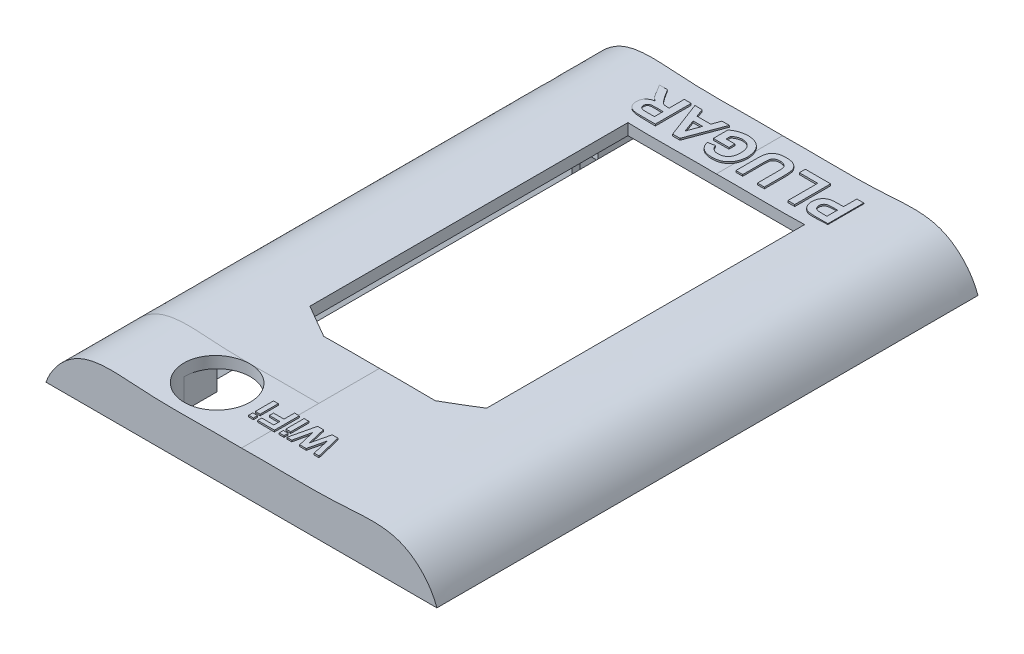
from build123d import *
from build123d.topology import SkipClean

# Parameters (mm, degrees)
CORPO_DA_TAMPA_DEPTH      = 84
TAMPA_SUPERIOR_DEPTH      = 14
ESBO_O6_W                 = 1.5
ESBO_O6_H                 = 2.969848481
ESBO_O6_W_2               = 13
GANCHO_TAMPA_DEPTH        = 1.5
GANCHO_TAMPA_TAPER        = -45
FURO_FURO_DEPTH           = 10
FURO_INTERNO_ANTENA_DEPTH = 5.369848481
FURO_ANTENA_R             = 6
CORTE_ANTENA_DEPTH        = 105.335973185
ESCRITO_W                 = 0.865384615
ESCRITO_H                 = 0.75
ESCRITO_H_2               = 3.288461538
ESCRITO_W_2               = 0.865384616
TEXTO_DEPTH               = 2.3


with BuildPart() as part:
    # Forma Principal → Corpo da Tampa (new body)
    with BuildSketch(Plane.XY):
        with BuildLine():
            Line((20.4, -12.030151519), (20.4, -9.630151519))
            Line((20.4, -9.630151519), (-20.4, -9.630151519))
            Line((-20.4, -9.630151519), (-20.4, -12.030151519))
            Line((-20.4, -12.030151519), (-18.91507576, -13.51507576))
            Line((-18.91507576, -13.51507576), (-20.4, -15))
            Line((-20.4, -15), (-35.4, -15))
            add(Edge.make_bspline(
                [(-35.4, -15), (-34.365163963, -12.038536121), (-29.36590771, -6.479950712), (-20.61057975, -7.407625726), (-11.04542218, -7.7779604), (-4.640956428, -7.543958391), (0, -7.630151519)],
                knots=[0, 0, 0, 0, 0.248558423, 0.508028441, 0.637570911, 1, 1, 1, 1], degree=3))
            add(Edge.make_bspline(
                [(35.4, -15), (34.365163963, -12.038536121), (29.36590771, -6.479950712), (20.61057975, -7.407625726), (11.04542218, -7.7779604), (4.640956428, -7.543958391), (0, -7.630151519)],
                knots=[0, 0, 0, 0, 0.248558423, 0.508028441, 0.637570911, 1, 1, 1, 1], degree=3))
            Line((35.4, -15), (20.4, -15))
            Line((20.4, -15), (18.91507576, -13.51507576))
            Line((18.91507576, -13.51507576), (20.4, -12.030151519))
        make_face()
    extrude(amount=CORPO_DA_TAMPA_DEPTH)

    # Esboço4 → Tampa Superior (add)
    with BuildSketch(Plane.XY.offset(84)):
        with BuildLine():
            Line((-35.4, -15), (35.4, -15))
            add(Edge.make_bspline(
                [(35.4, -15), (34.365164156, -12.038535769), (29.365907501, -6.479950972), (20.610579631, -7.407625041), (11.045422136, -7.777961222), (4.640956426, -7.543957764), (0, -7.630151526)],
                knots=[0, 0, 0, 0, 0.248558429, 0.508028447, 0.637570912, 1, 1, 1, 1], degree=3))
            add(Edge.make_bspline(
                [(-35.4, -15), (-34.365164156, -12.038535769), (-29.365907501, -6.479950972), (-20.610579631, -7.407625041), (-11.045422136, -7.777961222), (-4.640956426, -7.543957764), (0, -7.630151526)],
                knots=[0, 0, 0, 0, 0.248558429, 0.508028447, 0.637570912, 1, 1, 1, 1], degree=3))
        make_face()
    extrude(amount=TAMPA_SUPERIOR_DEPTH)

    # Esboço6 → Gancho Tampa (cut)
    with BuildSketch(Plane.ZY.offset(-20.4)):
        with Locations((17, -13.51507576)):
            Rectangle(ESBO_O6_W, ESBO_O6_H)
        with Locations((6.5, -13.51507576)):
            Rectangle(ESBO_O6_W_2, ESBO_O6_H)
    gancho_tampa = extrude(amount=GANCHO_TAMPA_DEPTH, taper=GANCHO_TAMPA_TAPER, mode=Mode.SUBTRACT)

    # Furo → Furo Furo (cut)
    with BuildSketch(Plane.XZ.offset(9.630151519)):
        Polygon((-16, 69.593633412), (-10.1, 73), (10.1, 73), (16, 69.593633412), (16, 12), (-16, 12), align=None)
    extrude(amount=-FURO_FURO_DEPTH, mode=Mode.SUBTRACT)

    # Gancho Espelho: Gancho Tampa across plane
    add(gancho_tampa.mirror(Plane(origin=(0, 0, 0), x_dir=(0, 0, 1), z_dir=(1, 0, 0))), mode=Mode.SUBTRACT)

    # Esboço Antena → Furo Interno Antena (cut)
    with BuildSketch(Plane.XZ.offset(15)):
        with BuildLine():
            Line((-6.4, 90), (-6.4, 84))
            Line((-6.4, 84), (-18.4, 84))
            Line((-18.4, 84), (-18.4, 90))
            ThreePointArc((-18.4, 90), (-12.4, 96), (-6.4, 90))
        make_face()
    extrude(amount=-FURO_INTERNO_ANTENA_DEPTH, mode=Mode.SUBTRACT)

    # Furo Antena → Corte Antena (cut, through all)
    with BuildSketch(Plane.XZ.offset(9.630151519)):
        with Locations((-12.4, 90)):
            Circle(FURO_ANTENA_R)
    extrude(amount=-CORTE_ANTENA_DEPTH, mode=Mode.SUBTRACT)

    # Escrito → Texto (add)
    # profile 1 of 12: a face of its own
    with SkipClean():  # the faces are left unmerged after this step: merging them gives an invalid solid
        with BuildSketch(Plane.XZ.offset(9.630151519)):
            with BuildLine():
                Line((-13.041666667, 3.5), (-13.041666667, 10))
                Line((-13.041666667, 10), (-15.76953125, 10))
                add(Edge.make_bspline(
                    [(-15.76953125, 10), (-15.852433751, 9.999489074), (-16.012202043, 9.998504425), (-16.243258164, 9.991324173), (-16.456343771, 9.976281126), (-16.652404118, 9.959244751), (-16.830497509, 9.934457924), (-16.991328096, 9.90476355), (-17.134625107, 9.870351864), (-17.262479332, 9.829138289), (-17.379056412, 9.781967921), (-17.487653682, 9.725821912), (-17.5894652, 9.660039962), (-17.686054692, 9.586889393), (-17.777831175, 9.506257808), (-17.862278626, 9.416011295), (-17.940868343, 9.317493655), (-18.013536914, 9.211524561), (-18.077553377, 9.098571929), (-18.136047616, 8.982263258), (-18.183664134, 8.861360851), (-18.222994944, 8.736434247), (-18.254413002, 8.607754678), (-18.276219789, 8.474994995), (-18.289833531, 8.338395496), (-18.291048832, 8.246126495), (-18.291666667, 8.19921875)],
                    knots=[0, 0, 0, 0, 1.675828044, 3.229627355, 4.67171229, 5.993455049, 7.206927059, 8.304770529, 9.29850117, 10.183580433, 11.017754134, 11.837875825, 12.650738409, 13.464925643, 14.285328857, 15.117007378, 15.959673368, 16.830859064, 17.711229498, 18.58228265, 19.460420693, 20.334473227, 21.228207035, 22.135446768, 23.052097822, 24, 24, 24, 24], degree=3))
                add(Edge.make_bspline(
                    [(-18.291666667, 8.19921875), (-18.290520676, 8.14012812), (-18.288281093, 8.024648743), (-18.267671273, 7.855391914), (-18.237060425, 7.693679097), (-18.193424898, 7.539286251), (-18.133426936, 7.394029257), (-18.063776636, 7.255873273), (-17.980706952, 7.125286925), (-17.884782253, 7.003564777), (-17.776088417, 6.890599081), (-17.654149103, 6.788714583), (-17.519834922, 6.697513096), (-17.372333353, 6.617520543), (-17.212671459, 6.549135577), (-17.040156893, 6.491598551), (-16.855570628, 6.444769821), (-16.727172525, 6.422735504), (-16.661458333, 6.411458333)],
                    knots=[0, 0, 0, 0, 1.05911256, 2.069797862, 3.05271628, 4.008392045, 4.940519534, 5.866323021, 6.779546087, 7.71056835, 8.640711998, 9.585328432, 10.554502533, 11.547017206, 12.589327225, 13.664782803, 14.804835066, 16, 16, 16, 16], degree=3))
                add(Edge.make_bspline(
                    [(-16.661458333, 6.411458333), (-16.725011337, 6.369366581), (-16.849393223, 6.286987288), (-17.021484516, 6.15130756), (-17.175981665, 6.008901192), (-17.292959113, 5.88226459), (-17.382844227, 5.770901302), (-17.455217101, 5.673501898), (-17.533282847, 5.561409311), (-17.616275811, 5.434562808), (-17.706649476, 5.294084679), (-17.801042682, 5.137824691), (-17.901430742, 4.967307026), (-17.968925799, 4.848191804), (-18.00390625, 4.786458333)],
                    knots=[0, 0, 0, 0, 1.285445069, 2.515791127, 3.691898215, 4.826622834, 5.420063933, 6.105349801, 6.873086501, 7.723915395, 8.66222816, 9.690593598, 10.803111229, 12, 12, 12, 12], degree=3))
                Line((-18.00390625, 4.786458333), (-18.791666667, 3.5))
                Line((-18.791666667, 3.5), (-17.330729167, 3.5))
                Line((-17.330729167, 3.5), (-16.40625, 4.975260417))
                add(Edge.make_bspline(
                    [(-16.40625, 4.975260417), (-16.363792405, 5.034343532), (-16.282732128, 5.147145345), (-16.165716611, 5.307440382), (-16.058657797, 5.450131756), (-15.96440488, 5.577286268), (-15.878188701, 5.685298788), (-15.802627128, 5.776051602), (-15.739259251, 5.851492131), (-15.667558341, 5.926294672), (-15.584141945, 6.003170848), (-15.480879109, 6.077706677), (-15.374837757, 6.137125853), (-15.261222919, 6.182464081), (-15.129830791, 6.214076906), (-14.971876645, 6.234218294), (-14.782394035, 6.249078384), (-14.645436069, 6.249677221), (-14.571614583, 6.25)],
                    knots=[0, 0, 0, 0, 1.465447777, 2.797841088, 3.997266218, 5.05856206, 5.985598736, 6.780315439, 7.437430484, 7.969193402, 8.866571936, 9.718200644, 10.52825214, 11.309096006, 12.174169268, 13.242355782, 14.513606761, 16, 16, 16, 16], degree=3))
                Line((-14.571614583, 6.25), (-14.291666667, 6.25))
                Line((-14.291666667, 6.25), (-14.291666667, 3.5))
                Line((-14.291666667, 3.5), (-13.041666667, 3.5))
            make_face()
            with BuildLine():
                Line((-14.291666667, 7.333333333), (-15.298177083, 7.333333333))
                add(Edge.make_bspline(
                    [(-15.298177083, 7.333333333), (-15.375871807, 7.333499838), (-15.523893384, 7.333817057), (-15.73438301, 7.33841185), (-15.922421124, 7.342311716), (-16.086882458, 7.352110297), (-16.228502825, 7.361821614), (-16.346714115, 7.374442802), (-16.44251229, 7.38936064), (-16.538198566, 7.41255396), (-16.636213824, 7.452963742), (-16.740679544, 7.510519167), (-16.829963809, 7.585184161), (-16.907304605, 7.671504445), (-16.966304797, 7.772981789), (-17.012515903, 7.885095263), (-17.035945912, 8.010336129), (-17.039719793, 8.097144358), (-17.041666667, 8.141927083)],
                    knots=[0, 0, 0, 0, 1.697953026, 3.23488743, 4.60134403, 5.807846676, 6.835100678, 7.703488618, 8.405232423, 8.952775585, 9.851109663, 10.713519226, 11.549115941, 12.382556273, 13.233359028, 14.101746968, 15.020727134, 16, 16, 16, 16], degree=3))
                add(Edge.make_bspline(
                    [(-17.041666667, 8.141927083), (-17.039452464, 8.19202582), (-17.035180516, 8.288683254), (-17.00149133, 8.426227704), (-16.942688229, 8.547729289), (-16.861929251, 8.65338861), (-16.760549078, 8.742608865), (-16.63979408, 8.813430327), (-16.500561383, 8.866175214), (-16.40013777, 8.885653798), (-16.34765625, 8.895833333)],
                    knots=[0, 0, 0, 0, 1.062977961, 2.050844577, 2.982300261, 3.90936959, 4.856017476, 5.831122378, 6.86654153, 8, 8, 8, 8], degree=3))
                add(Edge.make_bspline(
                    [(-16.34765625, 8.895833333), (-16.33030843, 8.897739486), (-16.289190456, 8.902257468), (-16.216580986, 8.905159169), (-16.123740465, 8.9096194), (-16.00954515, 8.911442197), (-15.875015255, 8.914637399), (-15.719615829, 8.915224119), (-15.543840589, 8.917098647), (-15.419705613, 8.916815931), (-15.354166667, 8.916666667)],
                    knots=[0, 0, 0, 0, 0.42127143, 0.998501726, 1.753681744, 2.66564073, 3.755712164, 5.002818897, 6.417592707, 8, 8, 8, 8], degree=3))
                Line((-15.354166667, 8.916666667), (-14.291666667, 8.916666667))
                Line((-14.291666667, 8.916666667), (-14.291666667, 7.333333333))
            make_face(mode=Mode.SUBTRACT)
        # profile 2 of 12: a face of its own
        with BuildSketch(Plane.XZ.offset(9.630151519)):
            Polygon((-12.375, 3.5), (-11.049479167, 3.5), (-10.501302083, 5), (-8.006510417, 5), (-7.458333333, 3.5), (-6.125, 3.5), (-8.58203125, 10), (-9.90625, 10), align=None)
            Polygon((-10.104166667, 6.083333333), (-9.25, 8.416666667), (-8.3984375, 6.083333333), align=None, mode=Mode.SUBTRACT)
        # profile 3 of 12: a face of its own
        with BuildSketch(Plane.XZ.offset(9.630151519)):
            with BuildLine():
                Line((-2.708333333, 5.916666667), (-2.708333333, 7))
                Line((-2.708333333, 7), (-5.541666667, 7))
                Line((-5.541666667, 7), (-5.541666667, 4.388020833))
                add(Edge.make_bspline(
                    [(-5.541666667, 4.388020833), (-5.506007566, 4.355910677), (-5.433113149, 4.290271021), (-5.314177681, 4.197702685), (-5.183240935, 4.109327816), (-5.04109445, 4.0233566), (-4.887444053, 3.940480978), (-4.722902584, 3.859546703), (-4.547166457, 3.781345288), (-4.298649881, 3.683382026), (-3.978758103, 3.576789901), (-3.587684009, 3.484104585), (-3.193516266, 3.427257023), (-2.929871012, 3.420194487), (-2.798177083, 3.416666667)],
                    knots=[0, 0, 0, 0, 0.581799769, 1.189316438, 1.825828404, 2.496525428, 3.203088405, 3.942228803, 4.719818701, 5.534979611, 7.181138583, 8.803804008, 10.403462225, 12, 12, 12, 12], degree=3))
                add(Edge.make_bspline(
                    [(-2.798177083, 3.416666667), (-2.715675138, 3.417906431), (-2.553039266, 3.420350376), (-2.312951659, 3.440021571), (-2.081169963, 3.473678895), (-1.857505293, 3.52133928), (-1.64120056, 3.578792799), (-1.433157397, 3.652083655), (-1.234114423, 3.740063474), (-1.042268303, 3.838098812), (-0.861195513, 3.950700377), (-0.690721129, 4.073876443), (-0.532079017, 4.208698409), (-0.385837905, 4.35543804), (-0.250039404, 4.513084711), (-0.126267979, 4.682390177), (-0.015272121, 4.863549897), (0.084318264, 5.054291422), (0.172917972, 5.252937232), (0.247680603, 5.457923884), (0.313225126, 5.666275196), (0.367095562, 5.878722642), (0.406660761, 6.095956925), (0.437417938, 6.316972915), (0.453937525, 6.543151533), (0.456858114, 6.695289152), (0.458333333, 6.772135417)],
                    knots=[0, 0, 0, 0, 1.124918047, 2.217548049, 3.282233239, 4.316494221, 5.334437038, 6.332151046, 7.320712088, 8.300141923, 9.267552434, 10.225301062, 11.165776911, 12.103230934, 13.047553934, 14.000517593, 14.959782875, 15.941944936, 16.932894943, 17.923491392, 18.915624898, 19.910402922, 20.909870877, 21.92519501, 22.95199481, 24, 24, 24, 24], degree=3))
                add(Edge.make_bspline(
                    [(0.458333333, 6.772135417), (0.457136949, 6.855076983), (0.454778358, 7.018590656), (0.434450611, 7.260261964), (0.402884024, 7.494851407), (0.35501536, 7.721933098), (0.29677831, 7.942564087), (0.2257033, 8.156599079), (0.138620724, 8.362452285), (0.041749279, 8.561884202), (-0.068525904, 8.752136891), (-0.193130659, 8.930770052), (-0.328377592, 9.099585394), (-0.476939291, 9.255901428), (-0.638292594, 9.399641986), (-0.810797261, 9.532396736), (-0.994040183, 9.656454209), (-1.125192095, 9.726403649), (-1.19140625, 9.76171875)],
                    knots=[0, 0, 0, 0, 1.105010302, 2.178452875, 3.229459892, 4.257086284, 5.268538906, 6.268935615, 7.259234261, 8.24469117, 9.221745683, 10.185929258, 11.144249683, 12.101504986, 13.055838221, 14.020611351, 15.000673771, 16, 16, 16, 16], degree=3))
                add(Edge.make_bspline(
                    [(-1.19140625, 9.76171875), (-1.243954007, 9.787810667), (-1.350682814, 9.840805493), (-1.520488792, 9.904077591), (-1.698082328, 9.961649054), (-1.886144697, 10.004604427), (-2.083398807, 10.039895584), (-2.289757239, 10.066232057), (-2.505883876, 10.080062354), (-2.652759939, 10.082226635), (-2.727864583, 10.083333333)],
                    knots=[0, 0, 0, 0, 0.887969848, 1.803539625, 2.741143579, 3.713741423, 4.722068772, 5.775476617, 6.8624965, 8, 8, 8, 8], degree=3))
                add(Edge.make_bspline(
                    [(-2.727864583, 10.083333333), (-2.824698333, 10.081890986), (-3.013022072, 10.079085886), (-3.287583984, 10.055712186), (-3.545982622, 10.015428383), (-3.788577826, 9.959946623), (-4.014846969, 9.888611807), (-4.224400534, 9.800914265), (-4.418524711, 9.698618885), (-4.594407848, 9.577625955), (-4.755624534, 9.444217091), (-4.901754079, 9.298230017), (-5.0328553, 9.139448498), (-5.14901493, 8.968671478), (-5.249318716, 8.785193066), (-5.335560814, 8.590686624), (-5.406548502, 8.383675523), (-5.440855278, 8.239909983), (-5.458333333, 8.166666667)],
                    knots=[0, 0, 0, 0, 1.271135529, 2.472123572, 3.614091059, 4.701890498, 5.736279567, 6.724681829, 7.680621489, 8.611506429, 9.52200816, 10.424540711, 11.318996785, 12.221421405, 13.131851814, 14.060431888, 15.011860567, 16, 16, 16, 16], degree=3))
                Line((-5.458333333, 8.166666667), (-4.208333333, 7.916666667))
                add(Edge.make_bspline(
                    [(-4.208333333, 7.916666667), (-4.195955961, 7.957684905), (-4.171535636, 8.038613125), (-4.124195238, 8.154780248), (-4.069669493, 8.263985027), (-4.007827609, 8.367017899), (-3.938046579, 8.463244545), (-3.858640498, 8.551626968), (-3.77460448, 8.636196645), (-3.680450189, 8.711067141), (-3.58008924, 8.778562552), (-3.474652485, 8.839425952), (-3.361757503, 8.888784473), (-3.242985662, 8.928498772), (-3.118917472, 8.962226691), (-2.987933794, 8.982969491), (-2.851505551, 8.998613571), (-2.758295387, 8.999532907), (-2.7109375, 9)],
                    knots=[0, 0, 0, 0, 1.027736275, 2.027704492, 3.005900071, 3.954421694, 4.908588141, 5.853155543, 6.803277083, 7.766271258, 8.734041521, 9.704274878, 10.683578894, 11.68490234, 12.708089448, 13.76461009, 14.864251086, 16, 16, 16, 16], degree=3))
                add(Edge.make_bspline(
                    [(-2.7109375, 9), (-2.63925968, 8.998087612), (-2.499374308, 8.994355425), (-2.295160306, 8.970002099), (-2.10250313, 8.926675299), (-1.920898993, 8.866914239), (-1.750014961, 8.790206733), (-1.592160208, 8.693691754), (-1.443404245, 8.583080237), (-1.307980146, 8.453259914), (-1.185165874, 8.307694238), (-1.078848154, 8.144646922), (-0.990339107, 7.964645001), (-0.917845153, 7.76859232), (-0.860124497, 7.556480703), (-0.820967535, 7.327559271), (-0.795383089, 7.082179215), (-0.792930898, 6.912829422), (-0.791666667, 6.825520833)],
                    knots=[0, 0, 0, 0, 1.043810997, 2.037086103, 2.989314757, 3.91471467, 4.817033861, 5.710208705, 6.603920097, 7.511448416, 8.435617211, 9.371747005, 10.338444094, 11.350425613, 12.411431869, 13.5347293, 14.729025275, 16, 16, 16, 16], degree=3))
                add(Edge.make_bspline(
                    [(-0.791666667, 6.825520833), (-0.792985002, 6.731713813), (-0.795547265, 6.549394393), (-0.820461086, 6.285225338), (-0.861444539, 6.039103928), (-0.920228259, 5.811340609), (-0.994196487, 5.601127312), (-1.083109603, 5.407792501), (-1.192839135, 5.23492372), (-1.316440072, 5.07905586), (-1.454588205, 4.9428595), (-1.603409589, 4.824119799), (-1.762075674, 4.723492208), (-1.932049601, 4.642565105), (-2.111187611, 4.578145046), (-2.301136586, 4.532982112), (-2.501330938, 4.504928561), (-2.638360256, 4.501666003), (-2.708333333, 4.5)],
                    knots=[0, 0, 0, 0, 1.318042826, 2.561693173, 3.724929596, 4.821196409, 5.862977565, 6.853497791, 7.804600806, 8.73339865, 9.643480846, 10.524649628, 11.404635349, 12.277659519, 13.165160235, 14.075017549, 15.017020959, 16, 16, 16, 16], degree=3))
                add(Edge.make_bspline(
                    [(-2.708333333, 4.5), (-2.779205662, 4.501970029), (-2.921628312, 4.505928932), (-3.134950995, 4.53947663), (-3.349108325, 4.588843148), (-3.559074259, 4.663313457), (-3.762986489, 4.748730378), (-3.953360333, 4.84717187), (-4.131639573, 4.949784224), (-4.238984443, 5.029760182), (-4.291666667, 5.069010417)],
                    knots=[0, 0, 0, 0, 0.993821502, 1.997150276, 3.023717651, 4.073291794, 5.118404464, 6.123376694, 7.078999408, 8, 8, 8, 8], degree=3))
                Line((-4.291666667, 5.069010417), (-4.291666667, 5.916666667))
                Line((-4.291666667, 5.916666667), (-2.708333333, 5.916666667))
            make_face()
        # profile 4 of 12: a face of its own
        with BuildSketch(Plane.XZ.offset(9.630151519)):
            with BuildLine():
                Line((6.708333333, 10), (5.458333333, 10))
                Line((5.458333333, 10), (5.458333333, 6.47265625))
                add(Edge.make_bspline(
                    [(5.458333333, 6.47265625), (5.45785613, 6.405816046), (5.456945102, 6.278211752), (5.456317991, 6.095904516), (5.452847482, 5.932220815), (5.445321342, 5.786896898), (5.440155944, 5.660006878), (5.430564361, 5.551527465), (5.420996024, 5.461500906), (5.411693303, 5.407952365), (5.407552083, 5.384114583)],
                    knots=[0, 0, 0, 0, 1.470600056, 2.807515117, 4.011048972, 5.072079398, 6.00911328, 6.804506435, 7.467811572, 8, 8, 8, 8], degree=3))
                add(Edge.make_bspline(
                    [(5.407552083, 5.384114583), (5.390478864, 5.319851409), (5.356859539, 5.193309104), (5.264192315, 5.020329133), (5.141780222, 4.867858182), (5.016915374, 4.759121851), (4.903965499, 4.682166344), (4.808023836, 4.635330113), (4.706230358, 4.592635876), (4.596433097, 4.55987695), (4.479810464, 4.531211711), (4.35495378, 4.514637269), (4.222916761, 4.501916797), (4.132413794, 4.500650359), (4.0859375, 4.5)],
                    knots=[0, 0, 0, 0, 1.376921055, 2.711331395, 4.038631339, 5.418057255, 6.132954575, 6.870556231, 7.630397752, 8.422890386, 9.247036838, 10.121396817, 11.035274583, 12, 12, 12, 12], degree=3))
                add(Edge.make_bspline(
                    [(4.0859375, 4.5), (4.039048001, 4.500850429), (3.947755104, 4.502506197), (3.815456111, 4.512366871), (3.692023412, 4.530970564), (3.577532516, 4.555363599), (3.471378722, 4.586192307), (3.374408909, 4.625225075), (3.286775887, 4.672197473), (3.183808407, 4.742996483), (3.073015534, 4.842870847), (2.966391538, 4.978662803), (2.890081578, 5.12856235), (2.854288973, 5.265431848), (2.835892776, 5.38468204), (2.824684823, 5.489030099), (2.814434584, 5.607115894), (2.805126583, 5.738615991), (2.798761104, 5.883629096), (2.795318128, 6.042521957), (2.792608487, 6.215269234), (2.79198809, 6.335068274), (2.791666667, 6.397135417)],
                    knots=[0, 0, 0, 0, 1.036876239, 2.018776863, 2.930845756, 3.794842666, 4.605604932, 5.371924355, 6.101864688, 6.799283669, 8.1310906, 9.382718023, 10.597336334, 11.822035891, 12.492591141, 13.265194674, 14.141890321, 15.11351293, 16.179860579, 17.351049011, 18.627594861, 20, 20, 20, 20], degree=3))
                Line((2.791666667, 6.397135417), (2.791666667, 10))
                Line((2.791666667, 10), (1.541666667, 10))
                Line((1.541666667, 10), (1.541666667, 6.600260417))
                add(Edge.make_bspline(
                    [(1.541666667, 6.600260417), (1.541826882, 6.506509478), (1.542134731, 6.326369627), (1.546941362, 6.067193325), (1.55715698, 5.829409933), (1.565711679, 5.612611855), (1.58221334, 5.417352165), (1.599490524, 5.243509458), (1.62174747, 5.091114117), (1.653486082, 4.917894665), (1.706824884, 4.723553585), (1.792788694, 4.508878938), (1.902653027, 4.313570963), (2.035980096, 4.136880282), (2.192001829, 3.978104633), (2.373054322, 3.837868217), (2.57727582, 3.714466155), (2.764421237, 3.625608958), (2.927588065, 3.565775434), (3.060484717, 3.525282786), (3.202714607, 3.491560882), (3.354110926, 3.464799552), (3.514738725, 3.442235791), (3.684656326, 3.427166896), (3.86360666, 3.417762843), (3.985664622, 3.417037932), (4.048177083, 3.416666667)],
                    knots=[0, 0, 0, 0, 1.415574045, 2.719986624, 3.913607924, 5.00929969, 5.995467356, 6.871900228, 7.64671288, 8.320227872, 9.530145585, 10.682614022, 11.803571353, 12.90325401, 14.015460715, 15.154679255, 16.351678057, 17.612271512, 18.275764165, 18.974412946, 19.708786676, 20.481351116, 21.295095879, 22.157200529, 23.056203067, 24, 24, 24, 24], degree=3))
                add(Edge.make_bspline(
                    [(4.048177083, 3.416666667), (4.123269151, 3.417626538), (4.268733679, 3.419485953), (4.479887536, 3.427780642), (4.676629197, 3.444901198), (4.859576787, 3.468041232), (5.028654771, 3.497788503), (5.184290876, 3.533351179), (5.325242576, 3.578297383), (5.493127363, 3.642491429), (5.680262962, 3.7406868), (5.88396798, 3.871678626), (6.062785955, 4.019526159), (6.215145702, 4.182784743), (6.34251252, 4.355717102), (6.44603924, 4.53458117), (6.529002146, 4.716395689), (6.563668757, 4.842760338), (6.580729167, 4.904947917)],
                    knots=[0, 0, 0, 0, 1.128613534, 2.186292659, 3.174878439, 4.095586888, 4.95671962, 5.754129884, 6.492676435, 7.178284149, 8.453103036, 9.659838108, 10.813193309, 11.929983019, 13.007587775, 14.033493319, 15.032227051, 16, 16, 16, 16], degree=3))
                add(Edge.make_bspline(
                    [(6.580729167, 4.904947917), (6.591170738, 4.953907511), (6.613164027, 5.057032072), (6.638142298, 5.220979908), (6.660929841, 5.401513934), (6.67649403, 5.598847691), (6.691247456, 5.812355075), (6.701839894, 6.042438656), (6.706195514, 6.289046188), (6.707606371, 6.459200681), (6.708333333, 6.546875)],
                    knots=[0, 0, 0, 0, 0.728071598, 1.533551606, 2.411422299, 3.374601532, 4.412367648, 5.524718474, 6.72457895, 8, 8, 8, 8], degree=3))
                Line((6.708333333, 6.546875), (6.708333333, 10))
            make_face()
        # profile 5 of 12: a face of its own
        with BuildSketch(Plane.XZ.offset(9.630151519)):
            Polygon((12.208333333, 3.5), (12.208333333, 10), (10.958333333, 10), (10.958333333, 4.583333333), (7.625, 4.583333333), (7.625, 3.5), align=None)
        # profile 6 of 12: a face of its own
        with BuildSketch(Plane.XZ.offset(9.630151519)):
            with BuildLine():
                Line((18.208333333, 3.5), (18.208333333, 10))
                Line((18.208333333, 10), (16.12890625, 10))
                add(Edge.make_bspline(
                    [(16.12890625, 10), (16.034719144, 9.999897143), (15.854575105, 9.999700417), (15.597610532, 9.99423455), (15.36625243, 9.986497013), (15.160844174, 9.976860238), (14.980662986, 9.962480319), (14.826517137, 9.945828589), (14.697435982, 9.927915746), (14.621423914, 9.909378349), (14.587239583, 9.901041667)],
                    knots=[0, 0, 0, 0, 1.460485487, 2.793352117, 3.985295279, 5.050041172, 5.981765236, 6.787433016, 7.454681457, 8, 8, 8, 8], degree=3))
                add(Edge.make_bspline(
                    [(14.587239583, 9.901041667), (14.541782737, 9.888080168), (14.451561546, 9.86235463), (14.322302715, 9.807511869), (14.197717669, 9.743952035), (14.079371687, 9.668200201), (13.966862474, 9.581601231), (13.859855601, 9.484861349), (13.757780414, 9.377543853), (13.662048995, 9.259860741), (13.574370276, 9.132405433), (13.498593833, 8.994989488), (13.435109018, 8.848210188), (13.381021011, 8.693170559), (13.341114621, 8.528208327), (13.313187403, 8.354469667), (13.293746575, 8.17187859), (13.292370104, 8.046928149), (13.291666667, 7.983072917)],
                    knots=[0, 0, 0, 0, 0.907145743, 1.80047177, 2.69161667, 3.591261238, 4.495029544, 5.415863088, 6.359363025, 7.337192411, 8.326890979, 9.326929023, 10.346104993, 11.395420813, 12.477187422, 13.601053412, 14.774031606, 16, 16, 16, 16], degree=3))
                add(Edge.make_bspline(
                    [(13.291666667, 7.983072917), (13.293672868, 7.886101487), (13.297534915, 7.699426159), (13.340744367, 7.431804451), (13.406649412, 7.187349273), (13.502974396, 6.968415236), (13.620414563, 6.774143206), (13.749777325, 6.599007888), (13.897490587, 6.448288039), (14.057081738, 6.319551317), (14.225740416, 6.214198524), (14.3947044, 6.124386764), (14.566253614, 6.055336614), (14.683215485, 6.025250908), (14.740885417, 6.010416667)],
                    knots=[0, 0, 0, 0, 1.312386234, 2.526415563, 3.661883817, 4.733421185, 5.753802465, 6.732107337, 7.675884281, 8.604170108, 9.50284679, 10.365392406, 11.194030444, 12, 12, 12, 12], degree=3))
                add(Edge.make_bspline(
                    [(14.740885417, 6.010416667), (14.782047385, 6.002586693), (14.868811904, 5.986082042), (15.00641524, 5.96962991), (15.156823144, 5.951419193), (15.320654254, 5.93954114), (15.497710377, 5.928417841), (15.687922761, 5.923166165), (15.891019572, 5.916838961), (16.030809703, 5.916725269), (16.102864583, 5.916666667)],
                    knots=[0, 0, 0, 0, 0.735353946, 1.55003838, 2.431865514, 3.394945452, 4.432993119, 5.54609699, 6.735134699, 8, 8, 8, 8], degree=3))
                Line((16.102864583, 5.916666667), (16.958333333, 5.916666667))
                Line((16.958333333, 5.916666667), (16.958333333, 3.5))
                Line((16.958333333, 3.5), (18.208333333, 3.5))
            make_face()
            with BuildLine():
                Line((16.958333333, 8.916666667), (16.958333333, 7))
                Line((16.958333333, 7), (16.208333333, 7))
                add(Edge.make_bspline(
                    [(16.208333333, 7), (16.143657514, 7.00008375), (16.019924535, 7.000243973), (15.842395157, 7.005995067), (15.681695396, 7.013015343), (15.537489475, 7.024635336), (15.410647859, 7.039950209), (15.300321121, 7.058268726), (15.206380679, 7.077926409), (15.104796879, 7.11050234), (14.996183487, 7.163207225), (14.880197149, 7.238957383), (14.778303287, 7.329525631), (14.693514089, 7.435894902), (14.625786292, 7.554077325), (14.57729314, 7.682861727), (14.545981158, 7.820113701), (14.543121094, 7.9151917), (14.541666667, 7.963541667)],
                    knots=[0, 0, 0, 0, 1.411705958, 2.700771114, 3.876961699, 4.922619712, 5.858038221, 6.66485904, 7.363650596, 7.950905807, 8.989198271, 9.987739806, 10.967313358, 11.951275539, 12.944273208, 13.927870418, 14.946261014, 16, 16, 16, 16], degree=3))
                add(Edge.make_bspline(
                    [(14.541666667, 7.963541667), (14.543713613, 8.022431171), (14.547682372, 8.136610154), (14.591446707, 8.299220082), (14.658970075, 8.446790562), (14.755509321, 8.574730013), (14.872126457, 8.682316569), (15.003199252, 8.771832409), (15.151526823, 8.834476275), (15.256502987, 8.858748461), (15.309895833, 8.87109375)],
                    knots=[0, 0, 0, 0, 1.085904563, 2.105425768, 3.088705091, 4.068969419, 5.045188284, 6.010769642, 6.988240112, 8, 8, 8, 8], degree=3))
                add(Edge.make_bspline(
                    [(15.309895833, 8.87109375), (15.332871995, 8.8747686), (15.38387195, 8.882925627), (15.468644255, 8.891438499), (15.568929905, 8.899180948), (15.684849785, 8.905537729), (15.815944417, 8.910507261), (15.96264621, 8.914861796), (16.124568798, 8.915211625), (16.237848283, 8.916168215), (16.296875, 8.916666667)],
                    knots=[0, 0, 0, 0, 0.564603001, 1.253243608, 2.066786758, 3.005752288, 4.070476343, 5.250658742, 6.567396469, 8, 8, 8, 8], degree=3))
                Line((16.296875, 8.916666667), (16.958333333, 8.916666667))
            make_face(mode=Mode.SUBTRACT)
        # profile 7 of 12: a face of its own
        with BuildSketch(Plane.XZ.offset(9.630151519)):
            with Locations((-3.763461539, 92.125)):
                Rectangle(ESCRITO_W, ESCRITO_H)
        # profile 8 of 12: a face of its own
        with BuildSketch(Plane.XZ.offset(9.630151519)):
            with Locations((-3.763461539, 89.644230769)):
                Rectangle(ESCRITO_W, ESCRITO_H_2)
        # profile 9 of 12: a face of its own
        with BuildSketch(Plane.XZ.offset(9.630151519)):
            Polygon((0.476923077, 88), (0.476923077, 92.5), (-2.580769231, 92.5), (-2.580769231, 91.75), (-0.388461538, 91.75), (-0.388461538, 90.653846154), (-2.292307692, 90.653846154), (-2.292307692, 89.903846154), (-0.388461538, 89.903846154), (-0.388461538, 88), align=None)
        # profile 10 of 12: a face of its own
        with BuildSketch(Plane.XZ.offset(9.630151519)):
            with Locations((1.775, 92.125)):
                Rectangle(ESCRITO_W_2, ESCRITO_H)
        # profile 11 of 12: a face of its own
        with BuildSketch(Plane.XZ.offset(9.630151519)):
            with Locations((1.775, 89.644230769)):
                Rectangle(ESCRITO_W_2, ESCRITO_H_2)
        # profile 12 of 12: a face of its own
        with BuildSketch(Plane.XZ.offset(9.630151519)):
            Polygon((7.476622596, 88), (8.553846154, 92.5), (7.666826923, 92.5), (6.967307692, 89.408954327), (6.227223558, 92.5), (5.046334135, 92.5), (4.313461538, 89.356670673), (3.615745192, 92.5), (2.726923077, 92.5), (3.784314904, 88), (4.856129808, 88), (5.640384615, 91.364182692), (6.445372596, 88), align=None)
        extrude(amount=-TEXTO_DEPTH)


solid = part.part
